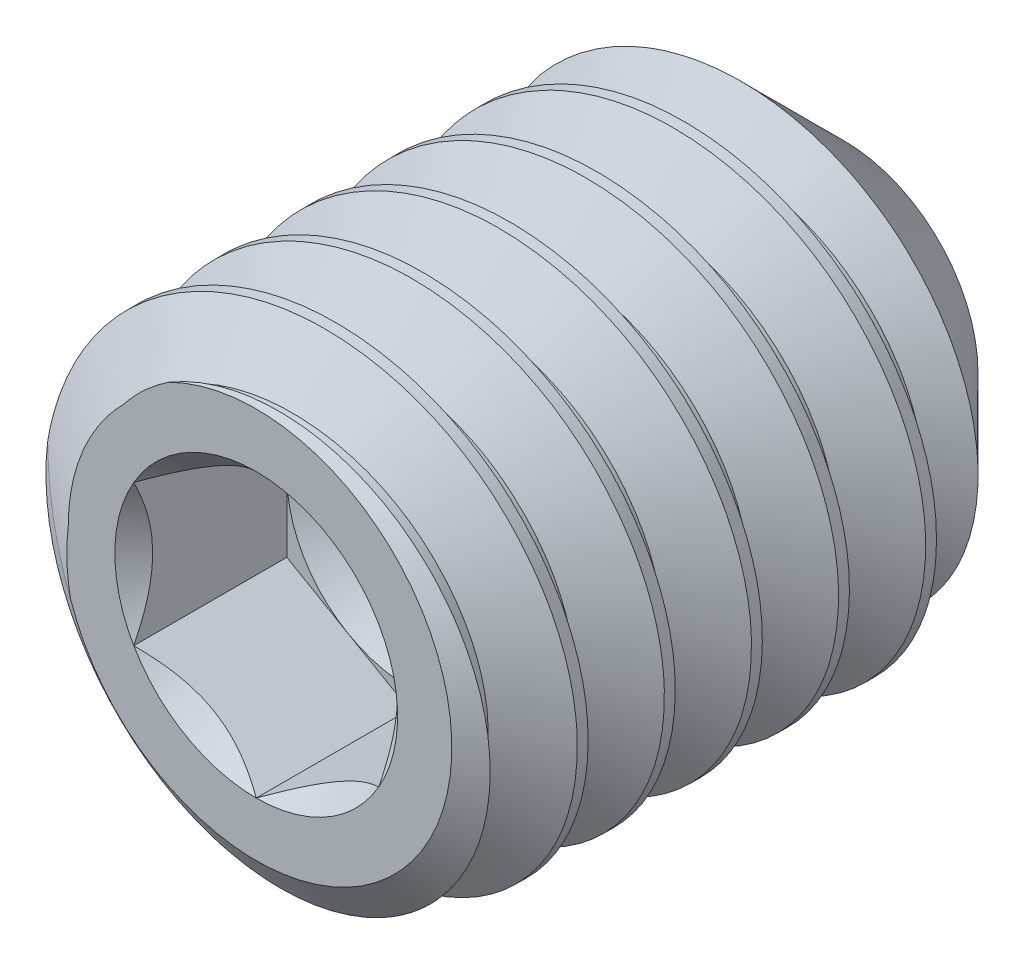
from build123d import *

# Parameters (mm, degrees)
CUT_SWEEP2_PITCH    = 1.411111111
CUT_EXTRUDE10_DEPTH = 2.48046875


with BuildPart() as part:
    # Sketch22 → Revolve1 (revolve)
    with BuildSketch(Plane(origin=(0, 0, 0), x_dir=(0, 0, -1), z_dir=(1, 0, 0)), mode=Mode.PRIVATE) as revolve1_sk:
        Polygon((-4.110188844, 0), (-4.110188844, 3.16992), (-3.555288375, 3.9624), (3.6236673, 3.9624), (5.414811156, 2.171256145), (4.110188844, 0), align=None)
    revolve(revolve1_sk.sketch.rotate(Axis((0, 0, -4.110188844), (0, 0, -1)), 180), axis=Axis((0, 0, -4.110188844), (0, 0, -1)))

    # Cut-Sweep2: the profile of Sketch28 profile screwed along a right-hand helix of 7.75 turns, 8 arcs to a turn; built about Z, then put on its axis
    cut_sweep2_z = Axis((0, 0, 0), (0, 0, 1))
    cut_sweep2_corners = [(3.9627, 0, 0.000173205), (3.9627, 0, -1.234895427), (3.045856448, 0, -0.705555556), (3.045856448, 0, -0.529166667)]
    with BuildLine(mode=Mode.PRIVATE) as cut_sweep2_profile:
        Line(cut_sweep2_corners[0], cut_sweep2_corners[1])
        Line(cut_sweep2_corners[1], cut_sweep2_corners[2])
        Line(cut_sweep2_corners[2], cut_sweep2_corners[3])
        Line(cut_sweep2_corners[3], cut_sweep2_corners[0])
    cut_sweep2_cap = Face(cut_sweep2_profile.wire())
    cut_sweep2_turn_angles = [0, 22.5, 45, 67.5, 90, 112.5, 135, 157.5, 180, 202.5, 225, 247.5, 270, 292.5, 315, 337.5, 360]
    cut_sweep2_turn_weights = [1, 0.9238795325112867, 1, 0.9238795325112867, 1, 0.9238795325112867, 1, 0.9238795325112867, 1, 0.9238795325112867, 1, 0.9238795325112867, 1, 0.9238795325112867, 1, 0.9238795325112867, 1]
    cut_sweep2_turn_rails = [Edge.make_bspline([Vector(p[0], p[1], 0).rotate(cut_sweep2_z, cut_sweep2_turn_angles[k]) / cut_sweep2_turn_weights[k] + Vector(0, 0, p[2] + CUT_SWEEP2_PITCH * cut_sweep2_turn_angles[k] / 360) for k in range(17)], [0, 0, 0, 1, 1, 2, 2, 3, 3, 4, 4, 5, 5, 6, 6, 7, 7, 8, 8, 8], 2, cut_sweep2_turn_weights) for p in cut_sweep2_corners]
    cut_sweep2_turn_sides = [Face.make_surface_from_curves(cut_sweep2_turn_rails[p[0]], cut_sweep2_turn_rails[p[1]]) for p in [(0, 1), (1, 2), (2, 3), (3, 0)]]
    cut_sweep2_last_angles = [2520, 2542.5, 2565, 2587.5, 2610, 2632.5, 2655, 2677.5, 2700, 2722.5, 2745, 2767.5, 2790]
    cut_sweep2_last_weights = [1, 0.9238795325112867, 1, 0.9238795325112867, 1, 0.9238795325112867, 1, 0.9238795325112867, 1, 0.9238795325112867, 1, 0.9238795325112519, 1]
    cut_sweep2_last_rails = [Edge.make_bspline([Vector(p[0], p[1], 0).rotate(cut_sweep2_z, cut_sweep2_last_angles[k]) / cut_sweep2_last_weights[k] + Vector(0, 0, p[2] + CUT_SWEEP2_PITCH * cut_sweep2_last_angles[k] / 360) for k in range(13)], [0, 0, 0, 1, 1, 2, 2, 3, 3, 4, 4, 5, 5, 6, 6, 6], 2, cut_sweep2_last_weights) for p in cut_sweep2_corners]
    cut_sweep2_last_sides = [Face.make_surface_from_curves(cut_sweep2_last_rails[p[0]], cut_sweep2_last_rails[p[1]]) for p in [(0, 1), (1, 2), (2, 3), (3, 0)]]
    cut_sweep2 = Plane(origin=(0, 0, -5.414811156), x_dir=(0, 1, 0), z_dir=(0, 0, 1)) * Solid(Shell([*[p.moved(Location((0, 0, CUT_SWEEP2_PITCH * i))) for i in range(7) for p in cut_sweep2_turn_sides], *cut_sweep2_last_sides, cut_sweep2_cap, cut_sweep2_cap.rotate(cut_sweep2_z, 2790).moved(Location((0, 0, CUT_SWEEP2_PITCH * 2790 / 360)))]))
    add(cut_sweep2, mode=Mode.SUBTRACT)

    # Sketch23 → Cut-Extrude10 (cut)
    with BuildSketch(Plane.XY.offset(4.110188844)):
        Polygon((0, 2.291358881), (-1.984375, 1.14567944), (-1.984375, -1.14567944), (0, -2.291358881), (1.984375, -1.14567944), (1.984375, 1.14567944), align=None)
    extrude(amount=-CUT_EXTRUDE10_DEPTH, mode=Mode.SUBTRACT)

    # Cut-Extrude11 cone 1 section (through the dimple's axis) → Cut-Extrude11 (revolve, cut)
    with BuildSketch(Plane(origin=(0, 0, 4.110188844), x_dir=(0, -1, 0), z_dir=(1, 0, 0))):
        Polygon((0, 0), (2.291358881, 0), (0, 2.291358881), align=None)
    revolve(axis=Axis((0, 0, 4.110188844), (0, 0, -1)), mode=Mode.SUBTRACT)

    # Cut-Extrude12 cone 1 section (through the dimple's axis) → Cut-Extrude12 (revolve, cut)
    with BuildSketch(Plane(origin=(0, 0, 1.629720094), x_dir=(0, -1, 0), z_dir=(1, 0, 0))):
        Polygon((0, 0), (1.984375, 0), (0, 1.14567944), align=None)
    revolve(axis=Axis((0, 0, 1.629720094), (0, 0, -1)), mode=Mode.SUBTRACT)


solid = part.part
